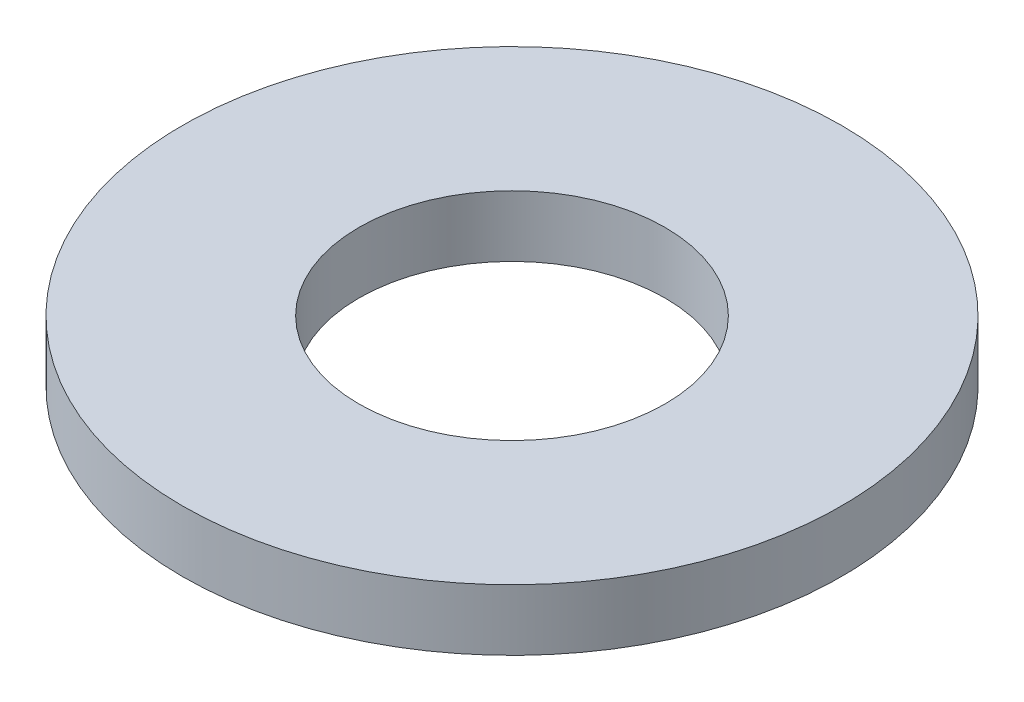
from build123d import *

# Parameters (mm, degrees)
SKETCH1_R           = 70
BOSS_EXTRUDE1_DEPTH = 13
SKETCH2_R           = 32.5
CUT_EXTRUDE1_DEPTH  = 100.844879688


with BuildPart() as part:
    # Sketch1 → Boss-Extrude1 (new body)
    with BuildSketch(Plane(origin=(0, 0, 0), x_dir=(1, 0, 0), z_dir=(0, 1, 0))):
        Circle(SKETCH1_R)
    extrude(amount=BOSS_EXTRUDE1_DEPTH)

    # Sketch2 → Cut-Extrude1 (cut, through all)
    with BuildSketch(Plane(origin=(0, 0, 0), x_dir=(1, 0, 0), z_dir=(0, 1, 0))):
        Circle(SKETCH2_R)
    extrude(amount=CUT_EXTRUDE1_DEPTH, mode=Mode.SUBTRACT)


solid = part.part
